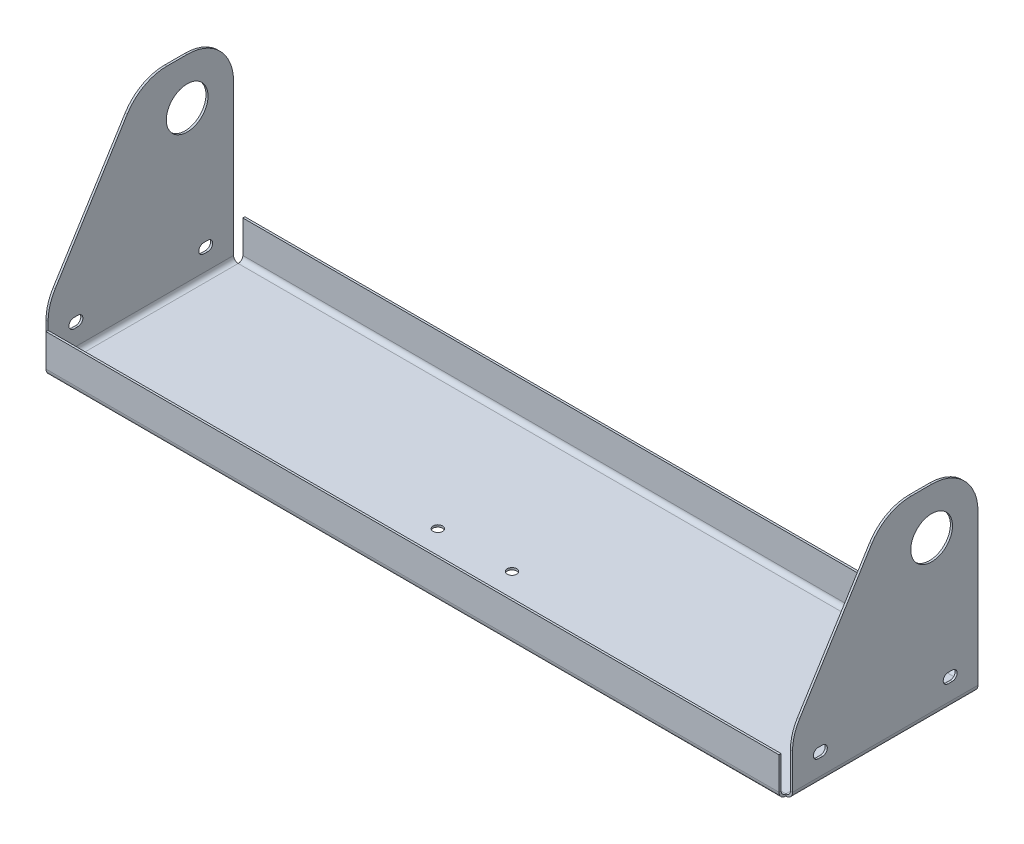
from build123d import *

# Parameters (mm, degrees)
SKETCH1_W                      = 511.175
SKETCH1_H                      = 127
BASE_FLANGE1_DEPTH             = 1.42875
EDGE_FLANGE1_STRIP_W           = 12.065
EDGE_FLANGE1_STRIP_H           = 1.42875
EDGE_FLANGE1_STRIP_CUT_DEPTH   = 127
EDGE_FLANGE1_STRIP_2_W         = 12.065
EDGE_FLANGE1_STRIP_2_H         = 1.42875
EDGE_FLANGE1_STRIP_CUT_2_DEPTH = 127
EDGE_FLANGE1_DEPTH             = 127
EDGE_FLANGE1_BEND_DEPTH        = 127
CUT_EXTRUDE1_DEPTH             = 534.339544007
FILLET1_R                      = 31.75
SKETCH14_R                     = 14.28115
CUT_EXTRUDE2_DEPTH             = 534.339544007
H_START                        = -255.5875
H_0_266_DIAMETER_SLOT1_DEPTH   = 511.175
F_0_257_DIAMETER_HOLE2_D       = 6.5278
EDGE_FLANGE2_DEPTH             = 501.9675
EDGE_FLANGE2_BEND_DEPTH        = 501.9675


# Read off the part's stored shape, not the designer's step: H (0.266) Diameter Slot1
# Sheet-metal steps are written as plain solids
with BuildPart() as part:
    # Sketch1 → Base-Flange1 (new body)
    with BuildSketch(Plane(origin=(0, 0, 0), x_dir=(1, 0, 0), z_dir=(0, 1, 0))):
        Rectangle(SKETCH1_W, SKETCH1_H)
    extrude(amount=-BASE_FLANGE1_DEPTH)

    # Edge-Flange1 strip (across the edge) → Edge-Flange1 strip cut (cut)
    with BuildSketch(Plane(origin=(255.5875, 0, 63.5), x_dir=(-1, 0, 0), z_dir=(0, 0, -1))):
        with Locations((-1.42875, -0.714375)):
            Rectangle(EDGE_FLANGE1_STRIP_W, EDGE_FLANGE1_STRIP_H)
    extrude(amount=EDGE_FLANGE1_STRIP_CUT_DEPTH, mode=Mode.SUBTRACT)

    # Edge-Flange1 strip 2 (across the edge) → Edge-Flange1 strip cut 2 (cut)
    with BuildSketch(Plane(origin=(-255.5875, 0, -63.5), x_dir=(1, 0, 0), z_dir=(0, 0, 1))):
        with Locations((-1.42875, -0.714375)):
            Rectangle(EDGE_FLANGE1_STRIP_2_W, EDGE_FLANGE1_STRIP_2_H)
    extrude(amount=EDGE_FLANGE1_STRIP_CUT_2_DEPTH, mode=Mode.SUBTRACT)

    # Edge-Flange1 section (across the edge) → Edge-Flange1 (add)
    with BuildSketch(Plane(origin=(255.5875, 0, 63.5), x_dir=(-1, 0, 0), z_dir=(0, 0, -1))):
        with BuildLine():
            Line((0, 3.175), (0, 138.27125))
            Line((0, 138.27125), (1.42875, 138.27125))
            Line((1.42875, 138.27125), (1.42875, 3.175))
            ThreePointArc((1.42875, 3.175), (2.35868597, 0.92993597), (4.60375, 0))
            Line((4.60375, 0), (4.60375, -1.42875))
            ThreePointArc((4.60375, -1.42875), (1.348407156, -0.080342844), (0, 3.175))
        make_face()
    extrude(amount=EDGE_FLANGE1_DEPTH)

    # Edge-Flange1 section 2 (across the edge) → Edge-Flange1 bend (add)
    with BuildSketch(Plane(origin=(-255.5875, 0, -63.5), x_dir=(1, 0, 0), z_dir=(0, 0, 1))):
        with BuildLine():
            Line((0, 3.175), (0, 138.27125))
            Line((0, 138.27125), (1.42875, 138.27125))
            Line((1.42875, 138.27125), (1.42875, 3.175))
            ThreePointArc((1.42875, 3.175), (2.35868597, 0.92993597), (4.60375, 0))
            Line((4.60375, 0), (4.60375, -1.42875))
            ThreePointArc((4.60375, -1.42875), (1.348407156, -0.080342844), (0, 3.175))
        make_face()
    extrude(amount=EDGE_FLANGE1_BEND_DEPTH)

    # Sketch13 → Cut-Extrude1 (cut, through all)
    with BuildSketch(Plane(origin=(255.5875, 0, 0), x_dir=(0, 0, -1), z_dir=(1, 0, 0))):
        Polygon((-63.5, 36.67125), (0, 138.27125), (-63.5, 138.27125), align=None)
    extrude(amount=-CUT_EXTRUDE1_DEPTH, mode=Mode.SUBTRACT)

    # Fillet1
    fillet1_edges = [part.edges().sort_by_distance(p)[0] for p in [
        (254.873125, 138.27125, -63.5),
        (-254.873125, 138.27125, -63.5),
        (254.873125, 138.27125, 0),
        (254.873125, 36.67125, 63.5),
        (-254.873125, 138.27125, 0),
        (-254.873125, 36.67125, 63.5),
    ]]
    fillet(fillet1_edges, radius=FILLET1_R)

    # Sketch14 → Cut-Extrude2 (cut, through all)
    with BuildSketch(Plane(origin=(255.5875, 0, 0), x_dir=(0, 0, -1), z_dir=(1, 0, 0))):
        with Locations(Location((31.75, 106.52125, 0), (0, 0, 90))):
            Circle(SKETCH14_R)
    extrude(amount=-CUT_EXTRUDE2_DEPTH, mode=Mode.SUBTRACT)

    # H (0.266) Diameter Slot1 outline → H (0.266) Diameter Slot1 (cut)
    with BuildSketch(Plane.YZ.offset(H_START)):
        with BuildLine():
            ThreePointArc((20.99945, -43.0657), (17.62125, -39.6875), (14.24305, -43.0657))
            Line((14.24305, -43.0657), (14.24305, -45.8343))
            ThreePointArc((14.24305, -45.8343), (17.62125, -49.2125), (20.99945, -45.8343))
            Line((20.99945, -45.8343), (20.99945, -43.0657))
        make_face()
        with BuildLine():
            ThreePointArc((20.99945, 45.8343), (17.62125, 49.2125), (14.24305, 45.8343))
            Line((14.24305, 45.8343), (14.24305, 43.0657))
            ThreePointArc((14.24305, 43.0657), (17.62125, 39.6875), (20.99945, 43.0657))
            Line((20.99945, 43.0657), (20.99945, 45.8343))
        make_face()
    extrude(amount=H_0_266_DIAMETER_SLOT1_DEPTH, mode=Mode.SUBTRACT)

    # F (0.257) Diameter Hole2 (through all)
    with Locations(Plane(origin=(0, 0, 0), x_dir=(1, 0, 0), z_dir=(0, 1, 0))):
        with Locations((-25.4, -25.4), (25.4, -25.4)):
            Hole(F_0_257_DIAMETER_HOLE2_D / 2)

    # Edge-Flange2 section (across the edge) → Edge-Flange2 (add)
    with BuildSketch(Plane(origin=(-250.98375, 0, 66.675), x_dir=(0, 0, -1), z_dir=(1, 0, 0))):
        with BuildLine():
            Line((-1.42875, 3.175), (-1.42875, 25.4))
            Line((-1.42875, 25.4), (0, 25.4))
            Line((0, 25.4), (0, 3.175))
            ThreePointArc((0, 3.175), (0.92993597, 0.92993597), (3.175, 0))
            Line((3.175, 0), (3.175, -1.42875))
            ThreePointArc((3.175, -1.42875), (-0.080342844, -0.080342844), (-1.42875, 3.175))
        make_face()
    extrude(amount=EDGE_FLANGE2_DEPTH)

    # Edge-Flange2 section 2 (across the edge) → Edge-Flange2 bend (add)
    with BuildSketch(Plane(origin=(250.98375, 0, -66.675), x_dir=(0, 0, 1), z_dir=(-1, 0, 0))):
        with BuildLine():
            Line((-1.42875, 3.175), (-1.42875, 25.4))
            Line((-1.42875, 25.4), (0, 25.4))
            Line((0, 25.4), (0, 3.175))
            ThreePointArc((0, 3.175), (0.92993597, 0.92993597), (3.175, 0))
            Line((3.175, 0), (3.175, -1.42875))
            ThreePointArc((3.175, -1.42875), (-0.080342844, -0.080342844), (-1.42875, 3.175))
        make_face()
    extrude(amount=EDGE_FLANGE2_BEND_DEPTH)


solid = part.part
